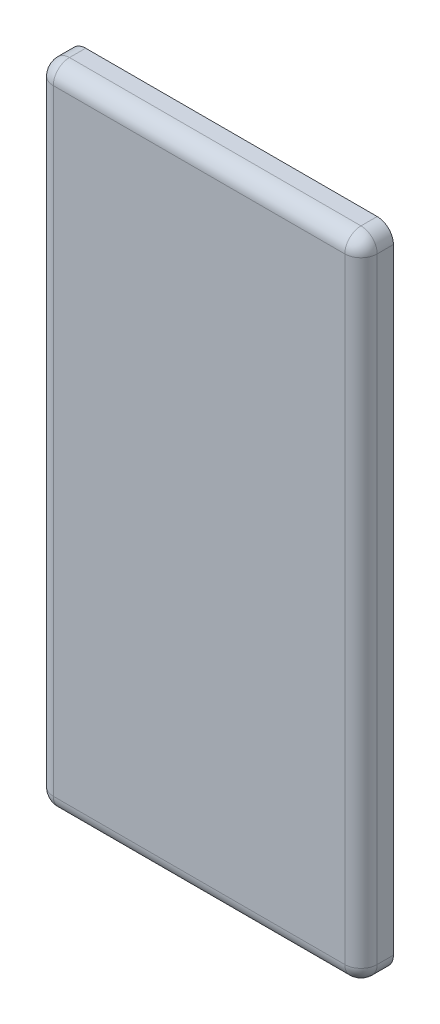
from build123d import *

# Parameters (mm, degrees)
CAP_SKETCH_W            = 20
CAP_SKETCH_H            = 40
EXTRUDE_THICKNESS_DEPTH = 2
CORNER_FILLETS_R        = 1
TOP_EDGE_FILLET_R       = 1


with BuildPart() as part:
    # Cap Sketch → Extrude Thickness (new body)
    with BuildSketch(Plane.XY):
        Rectangle(CAP_SKETCH_W, CAP_SKETCH_H)
    extrude(amount=EXTRUDE_THICKNESS_DEPTH)

    # Corner Fillets
    corner_fillets_edges = [part.edges().sort_by_distance(p)[0] for p in [
        (-10, -20, 1),
        (-10, 20, 1),
        (10, 20, 1),
        (10, -20, 1),
    ]]
    fillet(corner_fillets_edges, radius=CORNER_FILLETS_R)

    # Top Edge Fillet
    top_edge_fillet_edges = [part.edges().sort_by_distance(p)[0] for p in [
        (-9.707106781, 19.707106781, 2),
        (0, 20, 2),
        (9.707106781, 19.707106781, 2),
        (10, 0, 2),
        (9.707106781, -19.707106781, 2),
        (0, -20, 2),
        (-9.707106781, -19.707106781, 2),
        (-10, 0, 2),
    ]]
    fillet(top_edge_fillet_edges, radius=TOP_EDGE_FILLET_R)


solid = part.part
